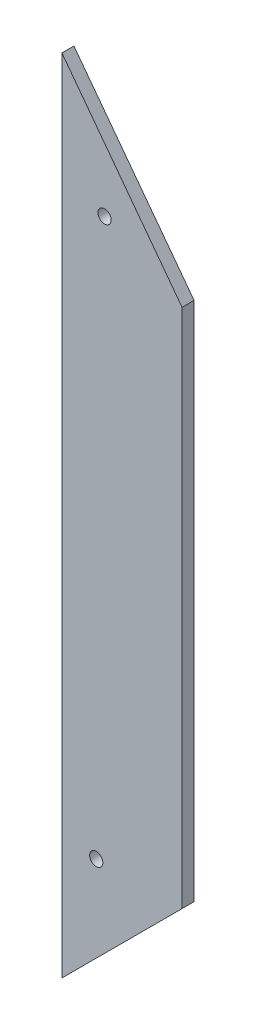
from build123d import *

# Parameters (mm, degrees)
EXTRUDE_1_DEPTH     = 3
SKETCH_5_R          = 1.65
CUT_EXTRUDE_1_DEPTH = 8


with BuildPart() as part:
    # Эскиз1 → Бобышка-Вытянуть1 (new body)
    with BuildSketch(Plane.XY):
        Polygon((0, 0), (0, 200), (30, 160), (30, 30), align=None)
    extrude(amount=EXTRUDE_1_DEPTH)

    # Эскиз5 → Вырез-Вытянуть1 (cut)
    with BuildSketch(Plane(origin=(-305.961161651, -184.204468703, -1.5), x_dir=(-0.9998892265297747, 0.01488404077153568, 0), z_dir=(0, 0, -1))):
        with Locations((-311.309295343, 358.877763083)):
            Circle(SKETCH_5_R)
        with Locations((-311.309295343, 218.877763083)):
            Circle(SKETCH_5_R)
    extrude(amount=-CUT_EXTRUDE_1_DEPTH, mode=Mode.SUBTRACT)


solid = part.part
